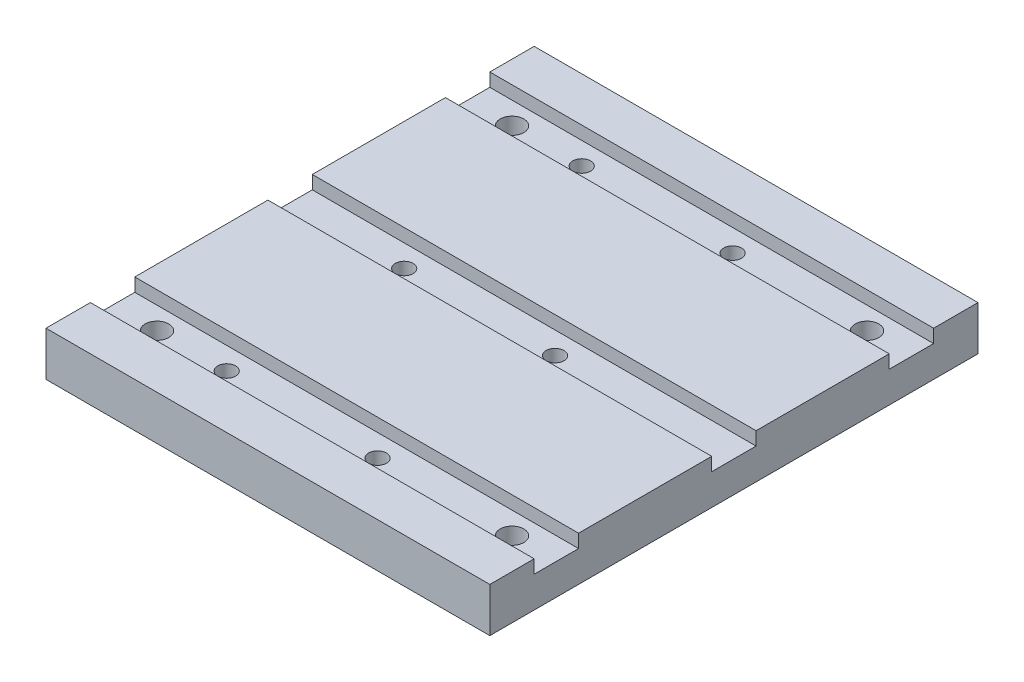
from build123d import *

# Parameters (mm, degrees)
SKETCH2_W                                       = 127
SKETCH2_H                                       = 139.7
BOSS_EXTRUDE1_DEPTH                             = 12.7
SKETCH4_W                                       = 12.7
SKETCH4_H                                       = 3.81
CUT_EXTRUDE1_DEPTH                              = 76.2
SKETCH5_W                                       = 12.7
SKETCH5_H                                       = 3.81
CUT_EXTRUDE2_DEPTH                              = 76.2
MIRROR3_COPY_1_SKETCH_W                         = 12.7
MIRROR3_COPY_1_SKETCH_H                         = 3.81
MIRROR3_COPY_1_DEPTH                            = 76.2
F_1_4_CLEARANCE_HOLE1_D                         = 6.7564
CBORE_FOR_10_SOCKET_HEAD_CAP_SCREW1_D           = 5.1054
CBORE_FOR_10_SOCKET_HEAD_CAP_SCREW1_CBORE_D     = 9.525
CBORE_FOR_10_SOCKET_HEAD_CAP_SCREW1_CBORE_DEPTH = 4.826
CBORE_FOR_10_SOCKET_HEAD_CAP_SCREW2_D           = 5.1054
CBORE_FOR_10_SOCKET_HEAD_CAP_SCREW2_CBORE_D     = 9.525
CBORE_FOR_10_SOCKET_HEAD_CAP_SCREW2_CBORE_DEPTH = 4.826
CBORE_FOR_10_SOCKET_HEAD_CAP_SCREW3_D           = 5.1054
CBORE_FOR_10_SOCKET_HEAD_CAP_SCREW3_CBORE_D     = 9.525
CBORE_FOR_10_SOCKET_HEAD_CAP_SCREW3_CBORE_DEPTH = 4.826
CBORE_FOR_10_SOCKET_HEAD_CAP_SCREW4_D           = 5.1054
CBORE_FOR_10_SOCKET_HEAD_CAP_SCREW4_CBORE_D     = 9.525
CBORE_FOR_10_SOCKET_HEAD_CAP_SCREW4_CBORE_DEPTH = 4.826


with BuildPart() as part:
    # Sketch2 → Boss-Extrude1 (new body)
    with BuildSketch(Plane(origin=(0, 0, 0), x_dir=(1, 0, 0), z_dir=(0, 1, 0))):
        Rectangle(SKETCH2_W, SKETCH2_H)
    extrude(amount=BOSS_EXTRUDE1_DEPTH)

    # Sketch4 → Cut-Extrude1 (cut)
    with BuildSketch(Plane(origin=(63.5, 0, 0), x_dir=(0, 0, -1), z_dir=(1, 0, 0))):
        with Locations((-50.8, 10.795)):
            Rectangle(SKETCH4_W, SKETCH4_H)
    cut_extrude1 = extrude(amount=-CUT_EXTRUDE1_DEPTH, mode=Mode.SUBTRACT)

    # Mirror1: Cut-Extrude1 across plane
    add(cut_extrude1.mirror(Plane.XY), mode=Mode.SUBTRACT)

    # Sketch5 → Cut-Extrude2 (cut)
    with BuildSketch(Plane(origin=(63.5, 0, 0), x_dir=(0, 0, -1), z_dir=(1, 0, 0))):
        with Locations((0, 10.795)):
            Rectangle(SKETCH5_W, SKETCH5_H)
    cut_extrude2 = extrude(amount=-CUT_EXTRUDE2_DEPTH, mode=Mode.SUBTRACT)

    # Mirror3: Cut-Extrude1, Cut-Extrude2 across plane
    add(cut_extrude1.mirror(Plane(origin=(0, 0, 0), x_dir=(0, 0, 1), z_dir=(1, 0, 0))), mode=Mode.SUBTRACT)
    add(cut_extrude2.mirror(Plane(origin=(0, 0, 0), x_dir=(0, 0, 1), z_dir=(1, 0, 0))), mode=Mode.SUBTRACT)

    # Mirror3 copy 1 sketch → Mirror3 copy 1 (cut)
    with BuildSketch(Plane.ZY.offset(63.5)):
        with Locations((-50.8, 10.795)):
            Rectangle(MIRROR3_COPY_1_SKETCH_W, MIRROR3_COPY_1_SKETCH_H)
    extrude(amount=-MIRROR3_COPY_1_DEPTH, mode=Mode.SUBTRACT)

    # 1/4 Clearance Hole1 (through all)
    with Locations(Plane(origin=(0, 0, 0), x_dir=(-1, 0, 0), z_dir=(0, -1, 0))):
        with Locations((-50.8, -50.8), (-50.8, 50.8), (50.8, 50.8), (50.8, -50.8)):
            Hole(F_1_4_CLEARANCE_HOLE1_D / 2)

    # CBORE for #10 Socket Head Cap Screw1 (through all)
    with Locations(Plane(origin=(0, 0, 0), x_dir=(-1, 0, 0), z_dir=(0, -1, 0))):
        with Locations((30.85084, -50.8)):
            cbore_for_10_socket_head_cap_screw1 = CounterBoreHole(CBORE_FOR_10_SOCKET_HEAD_CAP_SCREW1_D / 2, CBORE_FOR_10_SOCKET_HEAD_CAP_SCREW1_CBORE_D / 2, CBORE_FOR_10_SOCKET_HEAD_CAP_SCREW1_CBORE_DEPTH)

    # CBORE for #10 Socket Head Cap Screw2 (through all)
    with Locations(Plane(origin=(0, 0, 0), x_dir=(-1, 0, 0), z_dir=(0, -1, 0))):
        with Locations((30.85084, 0)):
            CounterBoreHole(CBORE_FOR_10_SOCKET_HEAD_CAP_SCREW2_D / 2, CBORE_FOR_10_SOCKET_HEAD_CAP_SCREW2_CBORE_D / 2, CBORE_FOR_10_SOCKET_HEAD_CAP_SCREW2_CBORE_DEPTH)

    # Mirror4: CBORE for #10 Socket Head Cap Screw1 across plane
    add(cbore_for_10_socket_head_cap_screw1.mirror(Plane.XY), mode=Mode.SUBTRACT)

    # CBORE for #10 Socket Head Cap Screw3 (through all)
    with Locations(Plane(origin=(0, 0, 0), x_dir=(-1, 0, 0), z_dir=(0, -1, 0))):
        with Locations((-12.32916, -50.8), (-12.32916, 0)):
            CounterBoreHole(CBORE_FOR_10_SOCKET_HEAD_CAP_SCREW3_D / 2, CBORE_FOR_10_SOCKET_HEAD_CAP_SCREW3_CBORE_D / 2, CBORE_FOR_10_SOCKET_HEAD_CAP_SCREW3_CBORE_DEPTH)

    # CBORE for #10 Socket Head Cap Screw4 (through all)
    with Locations(Plane(origin=(0, 0, 0), x_dir=(-1, 0, 0), z_dir=(0, -1, 0))):
        with Locations((-12.32916, 50.8)):
            CounterBoreHole(CBORE_FOR_10_SOCKET_HEAD_CAP_SCREW4_D / 2, CBORE_FOR_10_SOCKET_HEAD_CAP_SCREW4_CBORE_D / 2, CBORE_FOR_10_SOCKET_HEAD_CAP_SCREW4_CBORE_DEPTH)


solid = part.part
